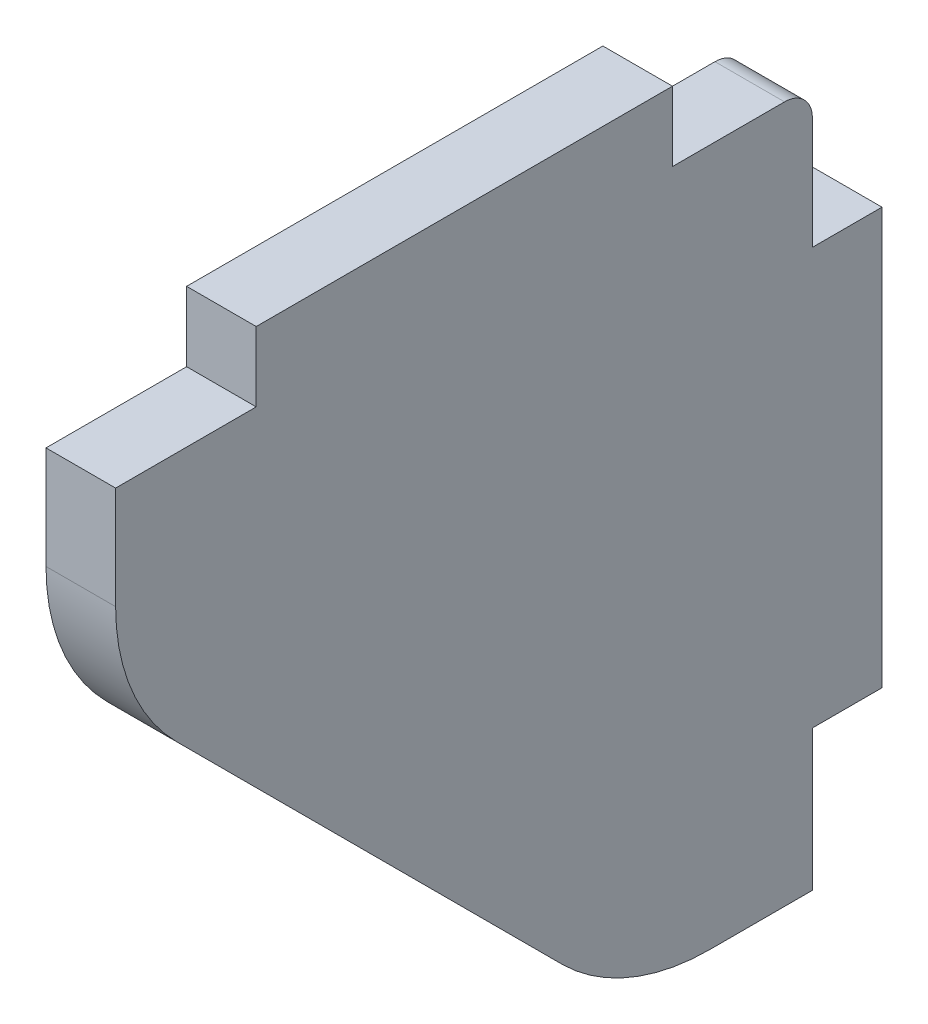
from build123d import *

# Parameters (mm, degrees)
BODY_MOVE_COPY1_START         = -65
BODY_MOVE_COPY1_OUTLINE_W     = 5.1
BODY_MOVE_COPY1_OUTLINE_H     = 30.1
BODY_MOVE_COPY1_OUTLINE_R     = 2.6
BODY_MOVE_COPY1_OUTLINE_R_2   = 3.1
BODY_MOVE_COPY1_OUTLINE_R_3   = 1.55
BODY_MOVE_COPY1_OUTLINE_W_2   = 30.5
BODY_MOVE_COPY1_OUTLINE_H_2   = 14.5
BODY_MOVE_COPY1_DEPTH         = 5
BODY_MOVE_COPY1_START_2       = -5
BODY_MOVE_COPY1_2_OUTLINE_W   = 10
BODY_MOVE_COPY1_2_OUTLINE_H   = 5.2
BODY_MOVE_COPY1_2_OUTLINE_R   = 1.6
BODY_MOVE_COPY1_2_OUTLINE_W_2 = 5.1
BODY_MOVE_COPY1_2_OUTLINE_H_2 = 30.1
BODY_MOVE_COPY1_2_DEPTH       = 5
BOSS_EXTRUDE2_DEPTH           = 5


# Read off the part's stored shape, not the designer's step: Body-Move/Copy1
with BuildPart() as part:
    # Body-Move/Copy1 outline → Body-Move/Copy1 (new body)
    with BuildSketch(Plane.XY.offset(BODY_MOVE_COPY1_START)):
        Polygon((24.9, -310), (24.9, -305), (100.2, -305), (100.2, -310), (150, -310), (150, -5), (10.65, -5), (10.65, 0), (-10.65, 0), (-10.65, -5), (-150, -5), (-150, -310), (-100.2, -310), (-100.2, -305), (-24.9, -305), (-24.9, -310), align=None)
        with Locations((-143.45, -280)):
            Rectangle(BODY_MOVE_COPY1_OUTLINE_W, BODY_MOVE_COPY1_OUTLINE_H, mode=Mode.SUBTRACT)
        with Locations((-90, -157.5)):
            Circle(BODY_MOVE_COPY1_OUTLINE_R, mode=Mode.SUBTRACT)
        with Locations((-60, -157.5)):
            Circle(BODY_MOVE_COPY1_OUTLINE_R, mode=Mode.SUBTRACT)
        with Locations((143.45, -280)):
            Rectangle(BODY_MOVE_COPY1_OUTLINE_W, BODY_MOVE_COPY1_OUTLINE_H, mode=Mode.SUBTRACT)
        with Locations((65, -157.5)):
            Circle(BODY_MOVE_COPY1_OUTLINE_R_2, mode=Mode.SUBTRACT)
        with Locations((85, -157.5)):
            Circle(BODY_MOVE_COPY1_OUTLINE_R_2, mode=Mode.SUBTRACT)
        with Locations((-90, -137.5)):
            Circle(BODY_MOVE_COPY1_OUTLINE_R_3, mode=Mode.SUBTRACT)
        with Locations((-60, -137.5)):
            Circle(BODY_MOVE_COPY1_OUTLINE_R_3, mode=Mode.SUBTRACT)
        with Locations((-75, -100.25)):
            Rectangle(BODY_MOVE_COPY1_OUTLINE_W_2, BODY_MOVE_COPY1_OUTLINE_H_2, mode=Mode.SUBTRACT)
        with Locations((-143.45, -30)):
            Rectangle(BODY_MOVE_COPY1_OUTLINE_W, BODY_MOVE_COPY1_OUTLINE_H, mode=Mode.SUBTRACT)
        with Locations((143.45, -30)):
            Rectangle(BODY_MOVE_COPY1_OUTLINE_W, BODY_MOVE_COPY1_OUTLINE_H, mode=Mode.SUBTRACT)
    extrude(amount=BODY_MOVE_COPY1_DEPTH)


with BuildPart() as body_2:
    # Body-Move_Copy1 2 outline → Body-Move_Copy1 2 (new body)
    with BuildSketch(Plane(origin=(0, 0, 0), x_dir=(1, 0, 0), z_dir=(0, 1, 0)).offset(BODY_MOVE_COPY1_START_2)):
        with BuildLine():
            ThreePointArc((-95, -65), (-93.535533906, -61.464466094), (-90, -60))
            Line((-90, -60), (90, -60))
            ThreePointArc((90, -60), (93.535533906, -61.464466094), (95, -65))
            Line((95, -65), (95, -70))
            ThreePointArc((95, -70), (96.464466094, -73.535533906), (100, -75))
            Line((100, -75), (115, -75))
            ThreePointArc((115, -75), (118.535533906, -73.535533906), (120, -70))
            Line((120, -70), (120, -60))
            Line((120, -60), (145.606601718, -34.393398282))
            ThreePointArc((145.606601718, -34.393398282), (148.858192988, -29.52704805), (150, -23.786796564))
            Line((150, -23.786796564), (150, 65))
            Line((150, 65), (10.75, 65))
            Line((10.75, 65), (10.75, 60))
            Line((10.75, 60), (-10.75, 60))
            Line((-10.75, 60), (-10.75, 65))
            Line((-10.75, 65), (-150, 65))
            Line((-150, 65), (-150, -23.786796564))
            ThreePointArc((-150, -23.786796564), (-148.858192988, -29.52704805), (-145.606601718, -34.393398282))
            Line((-145.606601718, -34.393398282), (-120, -60))
            Line((-120, -60), (-120, -70))
            ThreePointArc((-120, -70), (-118.535533906, -73.535533906), (-115, -75))
            Line((-115, -75), (-100, -75))
            ThreePointArc((-100, -75), (-96.464466094, -73.535533906), (-95, -70))
            Line((-95, -70), (-95, -65))
        make_face()
        with Locations((-107.5, -67.5)):
            Rectangle(BODY_MOVE_COPY1_2_OUTLINE_W, BODY_MOVE_COPY1_2_OUTLINE_H, mode=Mode.SUBTRACT)
        with Locations((-110, -52.5)):
            Circle(BODY_MOVE_COPY1_2_OUTLINE_R, mode=Mode.SUBTRACT)
        with Locations((-5, -52.5)):
            Circle(BODY_MOVE_COPY1_2_OUTLINE_R, mode=Mode.SUBTRACT)
        with Locations((5, -52.5)):
            Circle(BODY_MOVE_COPY1_2_OUTLINE_R, mode=Mode.SUBTRACT)
        with Locations((107.5, -67.5)):
            Rectangle(BODY_MOVE_COPY1_2_OUTLINE_W, BODY_MOVE_COPY1_2_OUTLINE_H, mode=Mode.SUBTRACT)
        with Locations((110, -52.5)):
            Circle(BODY_MOVE_COPY1_2_OUTLINE_R, mode=Mode.SUBTRACT)
        with Locations((-143.45, 35)):
            Rectangle(BODY_MOVE_COPY1_2_OUTLINE_W_2, BODY_MOVE_COPY1_2_OUTLINE_H_2, mode=Mode.SUBTRACT)
        with Locations((-110, 52.5)):
            Circle(BODY_MOVE_COPY1_2_OUTLINE_R, mode=Mode.SUBTRACT)
        with Locations((-5, 52.5)):
            Circle(BODY_MOVE_COPY1_2_OUTLINE_R, mode=Mode.SUBTRACT)
        with BuildLine():
            Line((131.606601718, -30.178932188), (115.267766953, -46.517766953))
            ThreePointArc((115.267766953, -46.517766953), (114.456708581, -47.059698831), (113.5, -47.25))
            Line((113.5, -47.25), (107.75, -47.25))
            ThreePointArc((107.75, -47.25), (105.982233047, -47.982233047), (105.25, -49.75))
            Line((105.25, -49.75), (105.25, -53.5))
            ThreePointArc((105.25, -53.5), (104.517766953, -55.267766953), (102.75, -56))
            Line((102.75, -56), (13.25, -56))
            ThreePointArc((13.25, -56), (11.482233047, -55.267766953), (10.75, -53.5))
            Line((10.75, -53.5), (10.75, -49.75))
            ThreePointArc((10.75, -49.75), (10.017766953, -47.982233047), (8.25, -47.25))
            Line((8.25, -47.25), (-8.25, -47.25))
            ThreePointArc((-8.25, -47.25), (-10.017766953, -47.982233047), (-10.75, -49.75))
            Line((-10.75, -49.75), (-10.75, -53.5))
            ThreePointArc((-10.75, -53.5), (-11.482233047, -55.267766953), (-13.25, -56))
            Line((-13.25, -56), (-102.75, -56))
            ThreePointArc((-102.75, -56), (-104.517766953, -55.267766953), (-105.25, -53.5))
            Line((-105.25, -53.5), (-105.25, -49.75))
            ThreePointArc((-105.25, -49.75), (-105.982233047, -47.982233047), (-107.75, -47.25))
            Line((-107.75, -47.25), (-113.5, -47.25))
            ThreePointArc((-113.5, -47.25), (-115.267766953, -46.517766953), (-116, -44.75))
            Line((-116, -44.75), (-116, 44.75))
            ThreePointArc((-116, 44.75), (-115.267766953, 46.517766953), (-113.5, 47.25))
            Line((-113.5, 47.25), (-107.75, 47.25))
            ThreePointArc((-107.75, 47.25), (-105.982233047, 47.982233047), (-105.25, 49.75))
            Line((-105.25, 49.75), (-105.25, 53.5))
            ThreePointArc((-105.25, 53.5), (-104.517766953, 55.267766953), (-102.75, 56))
            Line((-102.75, 56), (-13.25, 56))
            ThreePointArc((-13.25, 56), (-11.482233047, 55.267766953), (-10.75, 53.5))
            Line((-10.75, 53.5), (-10.75, 49.75))
            ThreePointArc((-10.75, 49.75), (-10.017766953, 47.982233047), (-8.25, 47.25))
            Line((-8.25, 47.25), (8.25, 47.25))
            ThreePointArc((8.25, 47.25), (10.017766953, 47.982233047), (10.75, 49.75))
            Line((10.75, 49.75), (10.75, 53.5))
            ThreePointArc((10.75, 53.5), (11.482233047, 55.267766953), (13.25, 56))
            Line((13.25, 56), (102.75, 56))
            ThreePointArc((102.75, 56), (104.517766953, 55.267766953), (105.25, 53.5))
            Line((105.25, 53.5), (105.25, 49.75))
            ThreePointArc((105.25, 49.75), (105.982233047, 47.982233047), (107.75, 47.25))
            Line((107.75, 47.25), (113.5, 47.25))
            ThreePointArc((113.5, 47.25), (115.267766953, 47.982233047), (116, 49.75))
            Line((116, 49.75), (116, 53.5))
            ThreePointArc((116, 53.5), (116.732233047, 55.267766953), (118.5, 56))
            Line((118.5, 56), (133.5, 56))
            ThreePointArc((133.5, 56), (135.267766953, 55.267766953), (136, 53.5))
            Line((136, 53.5), (136, -19.57233047))
            ThreePointArc((136, -19.57233047), (134.858192988, -25.312581956), (131.606601718, -30.178932188))
        make_face(mode=Mode.SUBTRACT)
        with Locations((5, 52.5)):
            Circle(BODY_MOVE_COPY1_2_OUTLINE_R, mode=Mode.SUBTRACT)
        with Locations((143.45, 35)):
            Rectangle(BODY_MOVE_COPY1_2_OUTLINE_W_2, BODY_MOVE_COPY1_2_OUTLINE_H_2, mode=Mode.SUBTRACT)
        with Locations((110, 52.5)):
            Circle(BODY_MOVE_COPY1_2_OUTLINE_R, mode=Mode.SUBTRACT)
    extrude(amount=BODY_MOVE_COPY1_2_DEPTH)


with BuildPart() as body_3:
    # Sketch18 → Boss-Extrude2 (new body)
    with BuildSketch(Plane(origin=(140.9, 0, 0), x_dir=(0, 0, -1), z_dir=(1, 0, 0))):
        with BuildLine():
            Line((20.05, 0), (20.05, -5))
            Line((20.05, -5), (9.95, -5))
            Line((9.95, -5), (9.95, -12.376406871))
            ThreePointArc((9.95, -12.376406871), (11.091807012, -18.116658357), (14.343398282, -22.983008589))
            Line((14.343398282, -22.983008589), (42.016991411, -50.656601718))
            ThreePointArc((42.016991411, -50.656601718), (46.883341643, -53.908192988), (52.623593129, -55.05))
            Line((52.623593129, -55.05), (60, -55.05))
            Line((60, -55.05), (60, -44.95))
            Line((60, -44.95), (65, -44.95))
            Line((65, -44.95), (65, -15.05))
            Line((65, -15.05), (60, -15.05))
            Line((60, -15.05), (60, -7))
            ThreePointArc((60, -7), (59.414213562, -5.585786438), (58, -5))
            Line((58, -5), (49.95, -5))
            Line((49.95, -5), (49.95, 0))
            Line((49.95, 0), (20.05, 0))
        make_face()
    extrude(amount=BOSS_EXTRUDE2_DEPTH)


solid = body_3.part
